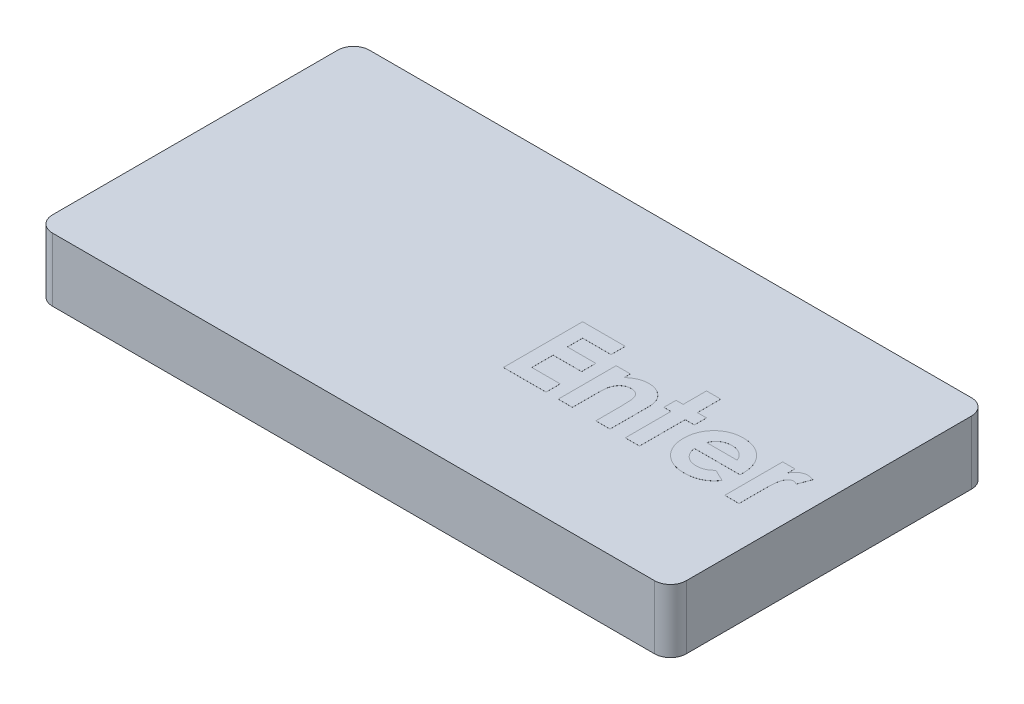
from build123d import *

# Parameters (mm, degrees)
SKETCH1_W           = 25.4
SKETCH1_H           = 12.7
BOSS_EXTRUDE1_DEPTH = 2.54
FILLET1_R           = 0.635
SHELL1_START        = 0.635
SHELL1_OUTLINE_W    = 1.905
SHELL1_OUTLINE_H    = 11.43
SHELL1_DEPTH        = 24.13
SKETCH2_R           = 2.54
BOSS_EXTRUDE2_DEPTH = 1.905
BOSS_EXTRUDE3_DEPTH = 0.00254


# Read off the part's stored shape, not the designer's step: Shell1
with BuildPart() as part:
    # Sketch1 → Boss-Extrude1 (new body)
    with BuildSketch(Plane(origin=(0, 0, 0), x_dir=(1, 0, 0), z_dir=(0, 1, 0))):
        with Locations((12.7, 6.35)):
            Rectangle(SKETCH1_W, SKETCH1_H)
    extrude(amount=BOSS_EXTRUDE1_DEPTH)

    # Fillet1
    fillet1_edges = [part.edges().sort_by_distance(p)[0] for p in [
        (0, 1.27, -12.7),
        (25.4, 1.27, -12.7),
        (25.4, 1.27, 0),
        (0, 1.27, 0),
    ]]
    fillet(fillet1_edges, radius=FILLET1_R)

    # Shell1 outline → Shell1 (cut)
    with BuildSketch(Plane.YZ.offset(SHELL1_START)):
        with Locations((0.9525, -6.35)):
            Rectangle(SHELL1_OUTLINE_W, SHELL1_OUTLINE_H)
    extrude(amount=SHELL1_DEPTH, mode=Mode.SUBTRACT)

    # Sketch2 → Boss-Extrude2 (add)
    with BuildSketch(Plane(origin=(0, 1.905, 0), x_dir=(-1, 0, 0), z_dir=(0, -1, 0))):
        with Locations(Location((-12.7, 6.35, 0), (0, 0, 270))):
            Circle(SKETCH2_R)
    extrude(amount=BOSS_EXTRUDE2_DEPTH)

    # Sketch3 → Boss-Extrude3 (add)
    # profile 1 of 5: a face of its own
    with BuildSketch(Plane(origin=(0, 2.54, 0), x_dir=(1, 0, 0), z_dir=(0, 1, 0))):
        Polygon((14.336346154, 7.5438), (16.045961538, 7.5438), (16.045961538, 6.973928205), (14.906217949, 6.973928205), (14.906217949, 6.363351282), (16.045961538, 6.363351282), (16.045961538, 5.793479487), (14.906217949, 5.793479487), (14.906217949, 4.938671795), (16.045961538, 4.938671795), (16.045961538, 4.3688), (14.336346154, 4.3688), align=None)
    # profile 2 of 5: a face of its own
    with BuildSketch(Plane(origin=(0, 2.54, 0), x_dir=(1, 0, 0), z_dir=(0, 1, 0))):
        with BuildLine():
            Line((16.534423077, 6.688992308), (17.104294872, 6.688992308))
            Line((17.104294872, 6.688992308), (17.104294872, 6.443489503))
            add(Edge.make_bspline(
                [(17.104294872, 6.443489503), (17.136805775, 6.468777153), (17.198940432, 6.517106769), (17.293395837, 6.578727275), (17.382550046, 6.629161185), (17.4683904, 6.667523797), (17.552531988, 6.695124047), (17.636337544, 6.714953181), (17.721055101, 6.72765032), (17.778005864, 6.72901543), (17.806458333, 6.729697436)],
                knots=[0, 0, 0, 0, 1.276643801, 2.439914479, 3.493451431, 4.44993799, 5.350072675, 6.235028322, 7.118224225, 8, 8, 8, 8], degree=3))
            add(Edge.make_bspline(
                [(17.806458333, 6.729697436), (17.835319535, 6.728918044), (17.891976497, 6.727388033), (17.975400753, 6.716686845), (18.055104527, 6.697196591), (18.131984023, 6.671318806), (18.20525674, 6.637161613), (18.275820312, 6.596605489), (18.34215906, 6.547205385), (18.383013398, 6.509584638), (18.403678886, 6.490554808)],
                knots=[0, 0, 0, 0, 1.048836932, 2.058954983, 3.049370783, 4.026390553, 5.001981509, 5.982488534, 6.97947532, 8, 8, 8, 8], degree=3))
            add(Edge.make_bspline(
                [(18.403678886, 6.490554808), (18.420253369, 6.47291972), (18.453523639, 6.437520476), (18.495390094, 6.376943303), (18.531316222, 6.310903097), (18.560752692, 6.238638062), (18.582505057, 6.159751149), (18.599239449, 6.075195199), (18.608629407, 5.984496762), (18.609788642, 5.922187791), (18.610384615, 5.890154167)],
                knots=[0, 0, 0, 0, 0.889584746, 1.785680191, 2.700364693, 3.65222533, 4.649950538, 5.707241244, 6.821271309, 8, 8, 8, 8], degree=3))
            Line((18.610384615, 5.890154167), (18.610384615, 4.3688))
            Line((18.610384615, 4.3688), (18.040512821, 4.3688))
            Line((18.040512821, 4.3688), (18.040512821, 5.376251923))
            add(Edge.make_bspline(
                [(18.040512821, 5.376251923), (18.040392305, 5.40911325), (18.04016136, 5.472085883), (18.038388212, 5.562209185), (18.034925994, 5.64360223), (18.031770272, 5.716413213), (18.025574336, 5.780383603), (18.01998674, 5.835918384), (18.011413117, 5.882513739), (18.000257442, 5.932634035), (17.980776886, 5.986296978), (17.950534273, 6.042839753), (17.912167277, 6.090874101), (17.86724296, 6.130736766), (17.815810937, 6.162271791), (17.758492689, 6.184458645), (17.69559551, 6.198286038), (17.651769495, 6.199763488), (17.629009415, 6.200530769)],
                knots=[0, 0, 0, 0, 1.49886392, 2.872294502, 4.110984203, 5.214877267, 6.195405875, 7.042225351, 7.75923308, 8.355011229, 9.382752534, 10.352059385, 11.267231453, 12.171456522, 13.078624015, 14.003401117, 14.963110155, 16, 16, 16, 16], degree=3))
            add(Edge.make_bspline(
                [(17.629009415, 6.200530769), (17.599408974, 6.199029723), (17.541504757, 6.196093385), (17.45775789, 6.173950715), (17.380837789, 6.136292551), (17.311372953, 6.084181225), (17.250024977, 6.019843335), (17.199497157, 5.943113021), (17.158053964, 5.855842165), (17.140232775, 5.792120264), (17.131007612, 5.759134535)],
                knots=[0, 0, 0, 0, 0.984188326, 1.925263693, 2.85911992, 3.81709677, 4.80007086, 5.801799564, 6.862098548, 8, 8, 8, 8], degree=3))
            add(Edge.make_bspline(
                [(17.131007612, 5.759134535), (17.128714793, 5.748775146), (17.123601344, 5.725671626), (17.11939618, 5.686640753), (17.113546491, 5.640334401), (17.111354756, 5.585914556), (17.107543571, 5.523638765), (17.106134013, 5.453424637), (17.104721932, 5.37540985), (17.104441941, 5.320919486), (17.104294872, 5.292297596)],
                knots=[0, 0, 0, 0, 0.543362196, 1.211806945, 2.009705693, 2.934833164, 4.000995085, 5.207458376, 6.533175157, 8, 8, 8, 8], degree=3))
            Line((17.104294872, 5.292297596), (17.104294872, 4.3688))
            Line((17.104294872, 4.3688), (16.534423077, 4.3688))
            Line((16.534423077, 4.3688), (16.534423077, 6.688992308))
        make_face()
    # profile 3 of 5: a face of its own
    with BuildSketch(Plane(origin=(0, 2.54, 0), x_dir=(1, 0, 0), z_dir=(0, 1, 0))):
        Polygon((19.220961538, 7.625210256), (19.790833333, 7.625210256), (19.790833333, 6.688992308), (20.157179487, 6.688992308), (20.157179487, 6.200530769), (19.790833333, 6.200530769), (19.790833333, 4.3688), (19.220961538, 4.3688), (19.220961538, 6.200530769), (18.936025641, 6.200530769), (18.936025641, 6.688992308), (19.220961538, 6.688992308), align=None)
    # profile 4 of 5: a face of its own
    with BuildSketch(Plane(origin=(0, 2.54, 0), x_dir=(1, 0, 0), z_dir=(0, 1, 0))):
        with BuildLine():
            Line((22.801104768, 5.386428205), (20.971282051, 5.386428205))
            add(Edge.make_bspline(
                [(20.971282051, 5.386428205), (20.975012912, 5.365166703), (20.982344348, 5.323386175), (20.998264821, 5.262696331), (21.018581733, 5.205503248), (21.042930272, 5.15173047), (21.070899923, 5.101093723), (21.103524203, 5.053830513), (21.140389303, 5.009982585), (21.18128208, 4.969740508), (21.225520924, 4.933682735), (21.272891295, 4.902093846), (21.323442074, 4.87619289), (21.376593716, 4.854361071), (21.432743388, 4.837068059), (21.491973725, 4.825141398), (21.554127719, 4.818096275), (21.596468918, 4.817077279), (21.618111979, 4.81655641)],
                knots=[0, 0, 0, 0, 1.091296461, 2.144483647, 3.168565212, 4.157007626, 5.126487748, 6.090021542, 7.05641414, 8.019231907, 8.98705074, 9.938580405, 10.892824166, 11.854447369, 12.841318655, 13.858982407, 14.905600794, 16, 16, 16, 16], degree=3))
            add(Edge.make_bspline(
                [(21.618111979, 4.81655641), (21.644236623, 4.817246126), (21.695683741, 4.81860438), (21.771054152, 4.830650072), (21.843948318, 4.84884456), (21.913676404, 4.875901292), (21.9810461, 4.909582167), (22.044948294, 4.951544392), (22.106489083, 5.000561696), (22.144036217, 5.038344214), (22.163179087, 5.057607091)],
                knots=[0, 0, 0, 0, 1.021034703, 2.010718019, 2.977989445, 3.954245119, 4.929443971, 5.918328161, 6.938689359, 8, 8, 8, 8], degree=3))
            Line((22.163179087, 5.057607091), (22.640192308, 4.830548798))
            add(Edge.make_bspline(
                [(22.640192308, 4.830548798), (22.625173825, 4.80979556), (22.595415253, 4.768673781), (22.546835384, 4.710804818), (22.496139197, 4.656810728), (22.443288883, 4.607046638), (22.388217415, 4.561654357), (22.331077988, 4.520080923), (22.271035533, 4.483442568), (22.209290589, 4.44996675), (22.144566771, 4.421268086), (22.077043201, 4.396794878), (22.007005878, 4.374671307), (21.933570382, 4.357814358), (21.857348211, 4.344470534), (21.778157024, 4.334994651), (21.696007261, 4.329141853), (21.640170545, 4.328448011), (21.611751803, 4.328094872)],
                knots=[0, 0, 0, 0, 1.028154879, 2.037251081, 3.030720504, 4.000128189, 4.949298328, 5.894184978, 6.834267904, 7.770992897, 8.712077017, 9.673380525, 10.653304757, 11.658697181, 12.695551717, 13.758623199, 14.859225354, 16, 16, 16, 16], degree=3))
            add(Edge.make_bspline(
                [(21.611751803, 4.328094872), (21.568030035, 4.328986227), (21.482403471, 4.330731895), (21.357159143, 4.346934193), (21.23821177, 4.373799348), (21.125225485, 4.410318401), (21.01868869, 4.458534992), (20.91854866, 4.517507882), (20.823804852, 4.586106444), (20.73735222, 4.665770377), (20.658591322, 4.752479833), (20.589412646, 4.845599867), (20.531524914, 4.944479886), (20.483986345, 5.04846548), (20.447037718, 5.157822811), (20.420399901, 5.272599602), (20.4040706, 5.392741033), (20.402306954, 5.474570758), (20.401410256, 5.516175801)],
                knots=[0, 0, 0, 0, 1.103565453, 2.161269334, 3.182010356, 4.179077853, 5.15417608, 6.128274628, 7.109042802, 8.101804412, 9.090965879, 10.063106201, 11.02526161, 11.978650795, 12.945248442, 13.93468508, 14.949922959, 16, 16, 16, 16], degree=3))
            add(Edge.make_bspline(
                [(20.401410256, 5.516175801), (20.40231578, 5.558838082), (20.404097356, 5.642774203), (20.420259306, 5.765689754), (20.447111363, 5.882967815), (20.484168073, 5.99476989), (20.530985476, 6.101445647), (20.589609729, 6.202061803), (20.658556992, 6.296968647), (20.737034156, 6.385722196), (20.823853028, 6.46583197), (20.916106282, 6.537225789), (21.014830478, 6.596715857), (21.11890896, 6.644783795), (21.227676005, 6.683837782), (21.342388807, 6.709824948), (21.462174577, 6.727273775), (21.544057492, 6.728880703), (21.58567508, 6.729697436)],
                knots=[0, 0, 0, 0, 1.079208495, 2.12329425, 3.130605359, 4.119693003, 5.099659317, 6.073216462, 7.060498243, 8.06384408, 9.066070512, 10.045757761, 11.010926815, 11.975797609, 12.942977511, 13.929384301, 14.947594487, 16, 16, 16, 16], degree=3))
            add(Edge.make_bspline(
                [(21.58567508, 6.729697436), (21.629606305, 6.728792252), (21.715860739, 6.727015016), (21.841977355, 6.710944278), (21.961714524, 6.683915301), (22.075582396, 6.647712022), (22.182126828, 6.598277429), (22.283688928, 6.540755769), (22.377832658, 6.470674397), (22.465561491, 6.391400313), (22.544754692, 6.303448465), (22.613978324, 6.207905819), (22.672879116, 6.105704817), (22.720618792, 5.996431011), (22.75752948, 5.880412453), (22.784191955, 5.757799814), (22.800396702, 5.628126736), (22.802127531, 5.539332148), (22.803012821, 5.493915184)],
                knots=[0, 0, 0, 0, 1.080001299, 2.120471247, 3.119684163, 4.095710327, 5.052285597, 6.002875087, 6.961153713, 7.931888285, 8.906493152, 9.865905668, 10.82813294, 11.801621613, 12.7925306, 13.817193356, 14.883530496, 16, 16, 16, 16], degree=3))
            Line((22.803012821, 5.493915184), (22.801104768, 5.386428205))
        make_face()
        with BuildLine():
            add(Edge.make_bspline(
                [(22.233141026, 5.834184615), (22.222387196, 5.863204845), (22.201005782, 5.92090462), (22.152706058, 6.000516231), (22.088613869, 6.069463119), (22.014070055, 6.130502347), (21.92889908, 6.180045596), (21.835784831, 6.215916518), (21.735904253, 6.237425172), (21.667191798, 6.23994776), (21.632104367, 6.241235897)],
                knots=[0, 0, 0, 0, 0.954238005, 1.897273737, 2.851915805, 3.847685534, 4.862635127, 5.880135777, 6.917509367, 8, 8, 8, 8], degree=3))
            add(Edge.make_bspline(
                [(21.632104367, 6.241235897), (21.59378318, 6.239998484), (21.518873238, 6.237579599), (21.410820748, 6.211853869), (21.308897537, 6.173458984), (21.248809389, 6.133873043), (21.218692909, 6.114032372)],
                knots=[0, 0, 0, 0, 1.044195649, 2.041185066, 3.018232172, 4, 4, 4, 4], degree=3))
            add(Edge.make_bspline(
                [(21.218692909, 6.114032372), (21.199902474, 6.098921282), (21.159842229, 6.066705211), (21.107815873, 6.002437207), (21.05656948, 5.924623082), (21.02743308, 5.865517757), (21.011987179, 5.834184615)],
                knots=[0, 0, 0, 0, 0.82159062, 1.751589201, 2.808063854, 4, 4, 4, 4], degree=3))
            Line((21.011987179, 5.834184615), (22.233141026, 5.834184615))
        make_face(mode=Mode.SUBTRACT)
    # profile 5 of 5: a face of its own
    with BuildSketch(Plane(origin=(0, 2.54, 0), x_dir=(1, 0, 0), z_dir=(0, 1, 0))):
        with BuildLine():
            Line((23.210064103, 6.688992308), (23.698525641, 6.688992308))
            Line((23.698525641, 6.688992308), (23.698525641, 6.403420393))
            add(Edge.make_bspline(
                [(23.698525641, 6.403420393), (23.71234328, 6.428799247), (23.739350429, 6.478403272), (23.788964827, 6.544986851), (23.845963857, 6.601061684), (23.908299367, 6.647800626), (23.976160285, 6.684229043), (24.047729415, 6.710188882), (24.122394486, 6.72705918), (24.173328465, 6.728811685), (24.199071514, 6.729697436)],
                knots=[0, 0, 0, 0, 1.09866127, 2.147379032, 3.14564304, 4.131443017, 5.102343063, 6.064490016, 7.021754664, 8, 8, 8, 8], degree=3))
            add(Edge.make_bspline(
                [(24.199071514, 6.729697436), (24.21776418, 6.728822129), (24.255829122, 6.727039691), (24.313845451, 6.716678355), (24.372698853, 6.697943087), (24.411429463, 6.681074469), (24.431217949, 6.672455849)],
                knots=[0, 0, 0, 0, 0.931404136, 1.896671404, 2.925354185, 4, 4, 4, 4], degree=3))
            Line((24.431217949, 6.672455849), (24.254405048, 6.18971847))
            add(Edge.make_bspline(
                [(24.254405048, 6.18971847), (24.2386005, 6.197354463), (24.208894033, 6.211707192), (24.165765401, 6.22864489), (24.126624379, 6.238979446), (24.101809689, 6.240521452), (24.0903125, 6.241235897)],
                knots=[0, 0, 0, 0, 1.214386998, 2.282580073, 3.20428172, 4, 4, 4, 4], degree=3))
            add(Edge.make_bspline(
                [(24.0903125, 6.241235897), (24.079456917, 6.240762468), (24.058102116, 6.239831151), (24.026583027, 6.231850083), (23.996898609, 6.218086977), (23.96761837, 6.200455073), (23.941052198, 6.175945407), (23.914502436, 6.147571118), (23.891105363, 6.112539283), (23.866414667, 6.073547072), (23.845391421, 6.025820641), (23.827364635, 5.968845117), (23.811302625, 5.901961255), (23.800249768, 5.824813934), (23.789566739, 5.738149687), (23.783207937, 5.641332411), (23.778468642, 5.534668249), (23.778178866, 5.460212815), (23.778027845, 5.421409175)],
                knots=[0, 0, 0, 0, 0.544232178, 1.070598461, 1.618251235, 2.182094276, 2.777567932, 3.425210017, 4.127676488, 4.886675562, 5.738955394, 6.734782583, 7.883056018, 9.186093582, 10.642914445, 12.264202625, 14.053029461, 16, 16, 16, 16], degree=3))
            Line((23.778027845, 5.421409175), (23.779935897, 5.308198037))
            Line((23.779935897, 5.308198037), (23.779935897, 4.3688))
            Line((23.779935897, 4.3688), (23.210064103, 4.3688))
            Line((23.210064103, 4.3688), (23.210064103, 6.688992308))
        make_face()
    extrude(amount=BOSS_EXTRUDE3_DEPTH)


solid = part.part
